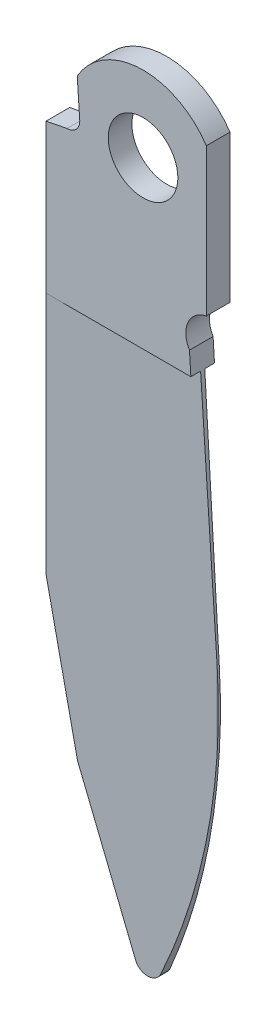
from build123d import *

# Parameters (mm, degrees)
BOSS_EXTRUDE1_DEPTH = 0.7112
SKETCH2_R           = 2.0955
CUT_EXTRUDE1_DEPTH  = 92.29153994
CUT_EXTRUDE2_DEPTH  = 49.6824
SKETCH4_W           = 0.6477
SKETCH4_H           = 4.658160897
CUT_EXTRUDE4_DEPTH  = 0.1524


with BuildPart() as part:
    # Sketch1 → Boss-Extrude1 (new, symmetric)
    with BuildSketch(Plane.XY):
        with BuildLine():
            Line((55.12919109, 58.646672801), (55.12919109, 35.024672801))
            Line((55.12919109, 35.024672801), (56.90719109, 26.134672801))
            Line((56.90719109, 26.134672801), (60.189853737, 17.244672801))
            ThreePointArc((60.189853737, 17.244672801), (60.87921761, 16.74704955), (61.600277456, 17.197520577))
            ThreePointArc((61.600277456, 17.197520577), (64.256854377, 25.79111845), (64.78119109, 34.770672801))
            Line((64.78119109, 34.770672801), (63.76519109, 51.026672801))
            ThreePointArc((63.76519109, 51.026672801), (63.676168886, 52.435016003), (64.78119109, 53.312672801))
            Line((64.78119109, 53.312672801), (64.78119109, 62.189940891))
            ThreePointArc((64.78119109, 62.189940891), (60.826349859, 64.232377935), (57.00879109, 61.943587144))
            Line((57.00879109, 61.943587144), (57.16119109, 59.662672801))
            ThreePointArc((57.16119109, 59.662672801), (56.938006458, 59.123857434), (56.39919109, 58.900672801))
            Line((56.39919109, 58.900672801), (55.12919109, 58.646672801))
        make_face()
    extrude(amount=BOSS_EXTRUDE1_DEPTH, both=True)

    # Sketch2 → Cut-Extrude1 (cut, through all)
    with BuildSketch(Plane.XY.offset(0.7112)):
        with Locations((60.97119109, 59.662672801)):
            Circle(SKETCH2_R)
    extrude(amount=-CUT_EXTRUDE1_DEPTH, mode=Mode.SUBTRACT)

    # Sketch3 → Cut-Extrude2 (cut)
    with BuildSketch(Plane(origin=(0, 0, 0), x_dir=(1, 0, 0), z_dir=(0, 1, 0))):
        Polygon((64.78119109, 0.0635), (55.12919109, 0.7112), (64.78119109, 0.7112), align=None)
        Polygon((55.12919109, -0.7112), (64.78119109, -0.0635), (64.78119109, -0.7112), align=None)
    extrude(amount=CUT_EXTRUDE2_DEPTH, mode=Mode.SUBTRACT)

    # Sketch4 → Cut-Extrude4 (cut)
    with BuildSketch(Plane.ZY.offset(-64.78119109)):
        with Locations((0.38735, 32.441592353)):
            Rectangle(SKETCH4_W, SKETCH4_H)
        with Locations((-0.38735, 32.441592353)):
            Rectangle(SKETCH4_W, SKETCH4_H)
    extrude(amount=-CUT_EXTRUDE4_DEPTH, mode=Mode.SUBTRACT)


solid = part.part
